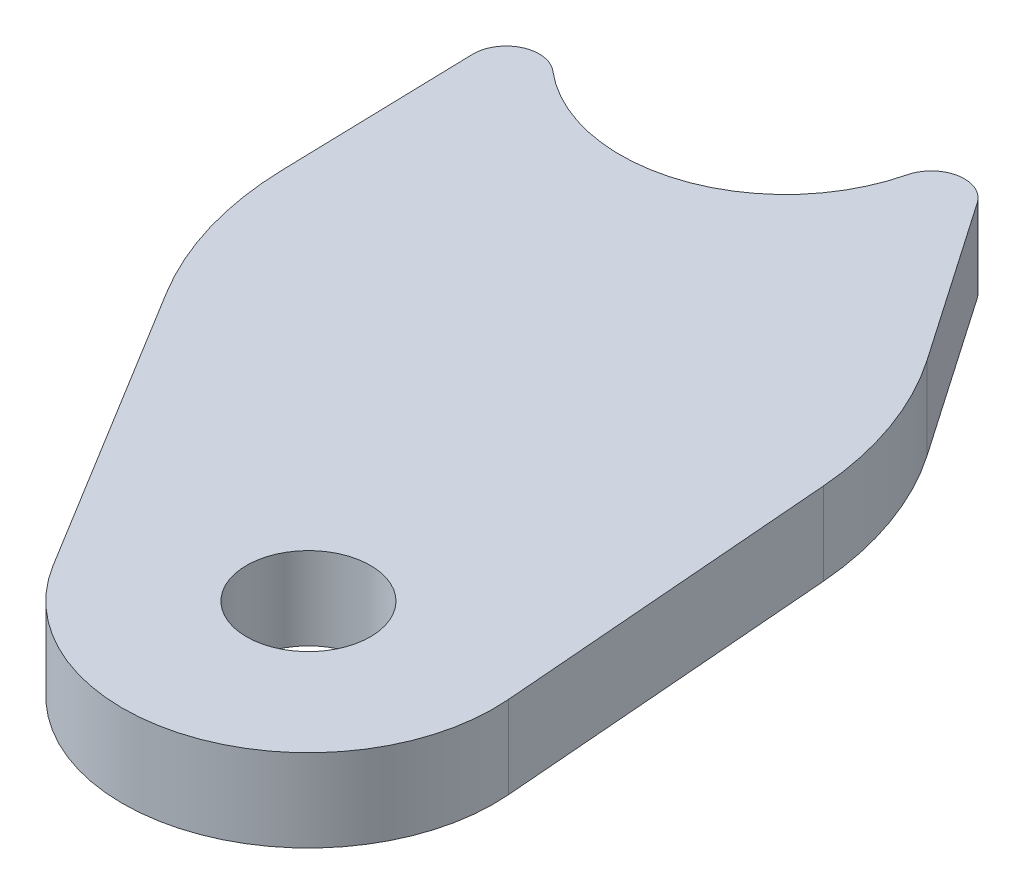
from build123d import *

# Parameters (mm, degrees)
SKETCH13_R              = 4.7625
BOSS_EXTRUDE1_DEPTH     = 6.35
CUT_EXTRUDE1_DEPTH      = 70.72307798468913
CUT_EXTRUDE1_DEPTH_BACK = 70.72307798468913
SKETCH14_R              = 12.700000000000005
FILLET1_R               = 2.54
FILLET2_R               = 25.4


with BuildPart() as part:
    # Sketch13 → Boss-Extrude1 (new body)
    with BuildSketch(Plane(origin=(0, 0, 0), x_dir=(1, 0, 0), z_dir=(0, 1, 0))):
        with BuildLine():
            Line((10.457197183965395, 61.616607390862896), (29.311250497613795, 34.258787574810775))
            Line((29.311250497613795, 34.258787574810775), (31.960429723513386, 1.1391939651281102))
            ThreePointArc((31.960429723513386, 1.1391939651281102), (22.142436087535806, -13.585312717476764), (5.536598892718167, -7.46565037863952))
            Line((5.536598892718167, -7.46565037863952), (-11.82466397940131, 20.862995599003614))
            Line((-11.82466397940131, 20.862995599003614), (-12.695635679614751, 54.07695410651815))
            Line((-12.695635679614751, 54.07695410651815), (10.457197183965395, 61.616607390862896))
        make_face()
        with Locations((17.71841816054182, 0)):
            Circle(SKETCH13_R, mode=Mode.SUBTRACT)
    extrude(amount=BOSS_EXTRUDE1_DEPTH)

    # Sketch14 → Cut-Extrude1 (cut, two sides: drawn at the far end of the back side and taken through both)
    with BuildSketch(Plane(origin=(0, 0, 0), x_dir=(1, 0, 0), z_dir=(0, 1, 0)).offset(-CUT_EXTRUDE1_DEPTH_BACK)):
        with Locations((3.247e-14, 54.409872550752084)):
            Circle(SKETCH14_R)
    extrude(amount=CUT_EXTRUDE1_DEPTH + CUT_EXTRUDE1_DEPTH_BACK, mode=Mode.SUBTRACT)

    # Fillet1
    fillet1_edges = [part.edges().sort_by_distance(p)[0] for p in [
        (10.457197183965395, 3.175, -61.616607390862896),
        (-12.695635679614751, 3.175, -54.07695410651815),
    ]]
    fillet(fillet1_edges, radius=FILLET1_R)

    # Fillet2
    fillet2_edges = [part.edges().sort_by_distance(p)[0] for p in [
        (29.311250497613795, 3.175, -34.258787574810775),
        (-11.82466397940131, 3.175, -20.862995599003614),
    ]]
    fillet(fillet2_edges, radius=FILLET2_R)


solid = part.part
